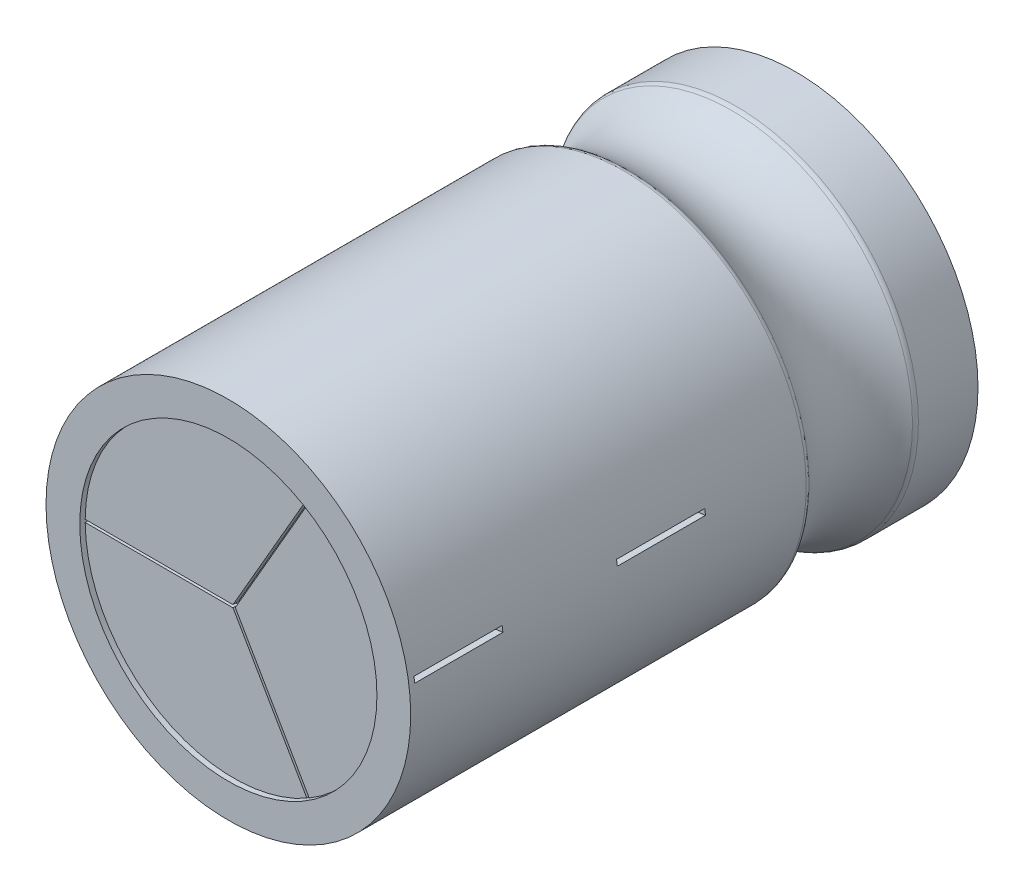
from build123d import *

# Parameters (mm, degrees)
SKETCH_1_R          = 6.75
EXTRUDE_1_DEPTH     = 21
SKETCH_2_R          = 5.5
CUT_EXTRUDE_1_DEPTH = 0.2
CUT_EXTRUDE_2_DEPTH = 0.2
FILLET_1_R          = 0.25
SKETCH_5_R          = 0.6
EXTRUDE_2_DEPTH     = 2
WRAP_START          = 10.027777778
WRAP_2_DEPTH        = 3.263888889
WRAP_START_2        = 17.527777778
WRAP_2_2_DEPTH      = 3.263888889


# Read off the part's stored shape, not the designer's step: 包覆2
with BuildPart() as part:
    # 草图1 → 凸台-拉伸1 (new body)
    with BuildSketch(Plane.XY):
        with Locations(Location((0, 0, 0), (0, 0, 180))):
            Circle(SKETCH_1_R)
    extrude(amount=EXTRUDE_1_DEPTH)

    # 草图2 → 切除-拉伸1 (cut)
    with BuildSketch(Plane.XY.offset(21)):
        Circle(SKETCH_2_R)
    extrude(amount=-CUT_EXTRUDE_1_DEPTH, mode=Mode.SUBTRACT)

    # 草图3 → 切除-拉伸2 (cut)
    with BuildSketch(Plane.XY.offset(20.8)):
        with BuildLine():
            Line((-0.04330127, 0.025), (-0.028867513, 0.05))
            Line((-0.028867513, 0.05), (-5.499772723, 0.05))
            ThreePointArc((-5.499772723, 0.05), (-5.5, 0), (-5.499772723, -0.05))
            Line((-5.499772723, -0.05), (-0.028867513, -0.05))
            Line((-0.028867513, -0.05), (-0.04330127, -0.025))
            Line((-0.04330127, -0.025), (0, 0))
            Line((0, 0), (-0.04330127, 0.025))
        make_face()
        with BuildLine():
            Line((0.04330127, -0.025), (0, 0))
            Line((0, 0), (0, -0.05))
            Line((0, -0.05), (-0.028867513, -0.05))
            Line((-0.028867513, -0.05), (2.706585091, -4.787942893))
            ThreePointArc((2.706585091, -4.787942893), (2.75, -4.763139721), (2.793187631, -4.737942893))
            Line((2.793187631, -4.737942893), (0.057735027, 0))
            Line((0.057735027, 0), (0.04330127, -0.025))
        make_face()
        with BuildLine():
            Line((-0.028867513, 0.05), (0, 0.05))
            Line((0, 0.05), (0, 0))
            Line((0, 0), (0.04330127, 0.025))
            Line((0.04330127, 0.025), (0.057735027, 0))
            Line((0.057735027, 0), (2.793187631, 4.737942893))
            ThreePointArc((2.793187631, 4.737942893), (2.75, 4.763139721), (2.706585091, 4.787942893))
            Line((2.706585091, 4.787942893), (-0.028867513, 0.05))
        make_face()
        Polygon((0, 0), (0, 0.05), (-0.028867513, 0.05), (-0.04330127, 0.025), align=None)
        Polygon((0, -0.05), (0, 0), (-0.04330127, -0.025), (-0.028867513, -0.05), align=None)
        Polygon((0.04330127, 0.025), (0, 0), (0.04330127, -0.025), (0.057735027, 0), align=None)
    extrude(amount=-CUT_EXTRUDE_2_DEPTH, mode=Mode.SUBTRACT)

    # 草图4 → 切除-旋转1 (revolve, cut)
    with BuildSketch(Plane(origin=(0, 0, 0), x_dir=(1, 0, 0), z_dir=(0, 1, 0))):
        with BuildLine():
            Line((-6.818421305, -2.223982894), (-6.818421305, -6.342581877))
            ThreePointArc((-6.818421305, -6.342581877), (-6, -4.283282386), (-6.818421305, -2.223982894))
        make_face()
    revolve(axis=Axis((0, 0, 0), (0, 0, 1)), mode=Mode.SUBTRACT)

    # 圆角1
    fillet_1_edges = [part.edges().sort_by_distance(p)[0] for p in [
        (6.75, 0, 6.267595869),
        (6.75, 0, 2.298968902),
    ]]
    fillet(fillet_1_edges, radius=FILLET_1_R)

    # 草图5 → 凸台-拉伸2 (add)
    with BuildSketch(Plane(origin=(0, 0, 0), x_dir=(-1, 0, 0), z_dir=(0, 0, -1))):
        with Locations(Location((2.54, 0, 0), (0, 0, 180))):
            Circle(SKETCH_5_R)
        with Locations(Location((-2.54, 0, 0), (0, 0, 180))):
            Circle(SKETCH_5_R)
    extrude(amount=EXTRUDE_2_DEPTH)

    # 包覆2 outline → 包覆2 (cut)
    with BuildSketch(Plane.XY.offset(WRAP_START)):
        with BuildLine():
            Line((6.661018662, 1.092396624), (5.674201083, 0.930560087))
            ThreePointArc((5.674201083, 0.930560087), (5.687885367, 0.842887927), (5.700215109, 0.755015037))
            Line((5.700215109, 0.755015037), (6.691556868, 0.886322))
            ThreePointArc((6.691556868, 0.886322), (6.677082822, 0.989477131), (6.661018662, 1.092396624))
        make_face()
    extrude(amount=WRAP_2_DEPTH, mode=Mode.SUBTRACT)

    # Wrap 2 2 outline → Wrap 2 2 (cut)
    with BuildSketch(Plane.XY.offset(WRAP_START_2)):
        with BuildLine():
            Line((6.661018662, 1.092396624), (5.674201083, 0.930560087))
            ThreePointArc((5.674201083, 0.930560087), (5.687885367, 0.842887927), (5.700215109, 0.755015037))
            Line((5.700215109, 0.755015037), (6.691556868, 0.886322))
            ThreePointArc((6.691556868, 0.886322), (6.677082822, 0.989477131), (6.661018662, 1.092396624))
        make_face()
    extrude(amount=WRAP_2_2_DEPTH, mode=Mode.SUBTRACT)


solid = part.part
